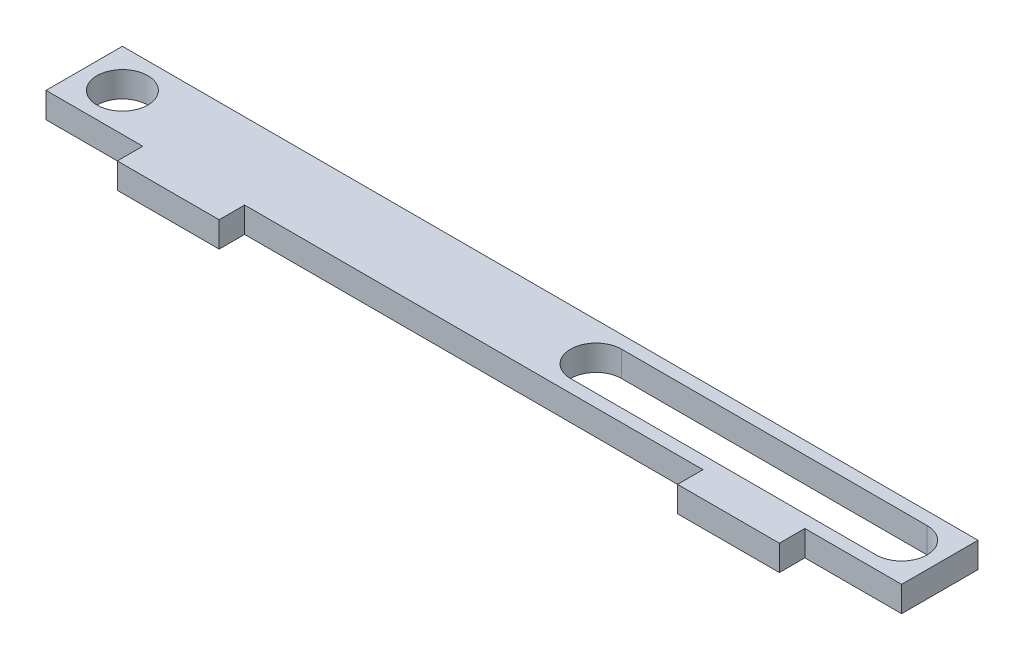
from build123d import *

# Parameters (mm, degrees)
SKETCH1_R           = 5
BOSS_EXTRUDE1_DEPTH = 5


with BuildPart() as part:
    # Sketch1 → Boss-Extrude1 (new body)
    with BuildSketch(Plane(origin=(0, 0, 0), x_dir=(1, 0, 0), z_dir=(0, 1, 0))):
        Polygon((0, 0), (19, 0), (19, -5), (39, -5), (39, 0), (129, 0), (129, -5), (149, -5), (149, 0), (168, 0), (168, 15), (0, 15), align=None)
        with Locations((7.5, 7.5)):
            Circle(SKETCH1_R, mode=Mode.SUBTRACT)
        with BuildLine():
            Line((160.5, 2.5), (100.5, 2.5))
            ThreePointArc((100.5, 2.5), (95.5, 7.5), (100.5, 12.5))
            Line((100.5, 12.5), (160.5, 12.5))
            ThreePointArc((160.5, 12.5), (165.5, 7.5), (160.5, 2.5))
        make_face(mode=Mode.SUBTRACT)
    extrude(amount=BOSS_EXTRUDE1_DEPTH)


solid = part.part
